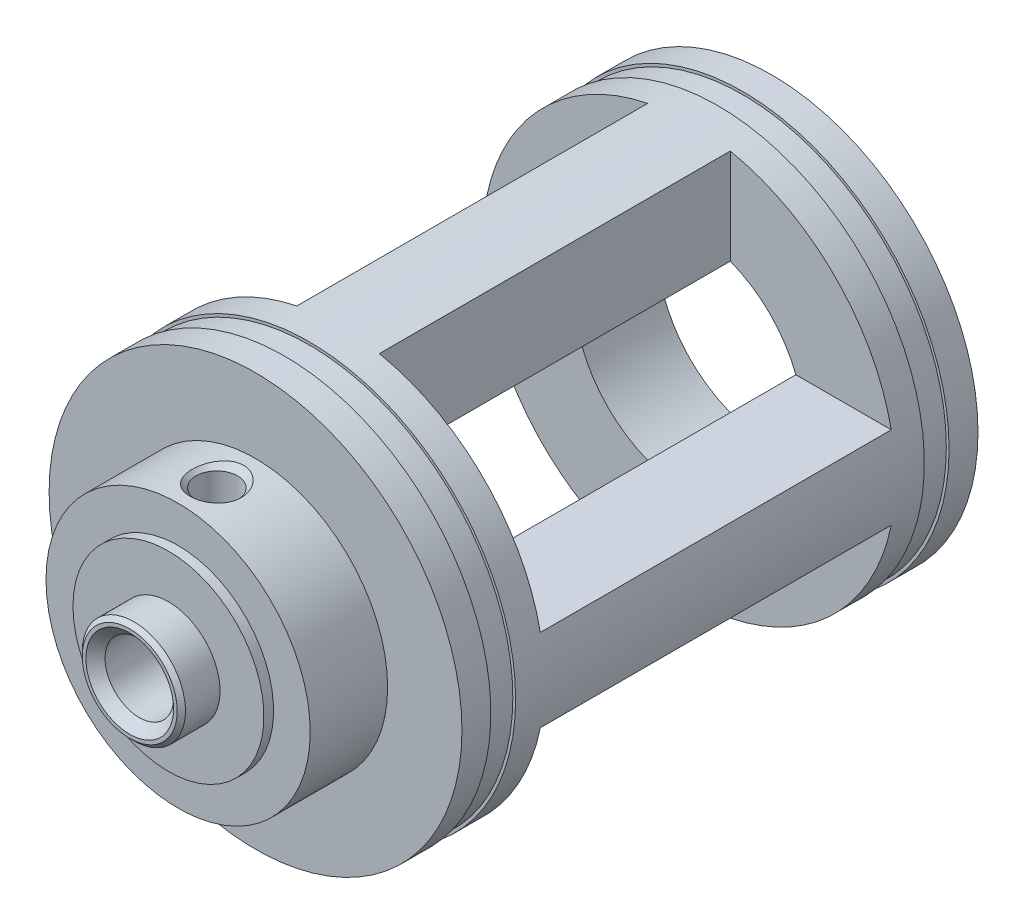
from build123d import *

# Parameters (mm, degrees)
SKETCH1_R                                      = 25.4
BOSS_EXTRUDE1_DEPTH                            = 63.5
SKETCH2_R                                      = 14.097
CUT_EXTRUDE1_DEPTH                             = 63.5
SKETCH4_W                                      = 20.32
SKETCH4_H                                      = 43.18
CUT_EXTRUDE3_DEPTH                             = 75.876167103
SKETCH8_R                                      = 14.097
BOSS_EXTRUDE3_DEPTH                            = 10.16
SKETCH10_R                                     = 16.256
BOSS_EXTRUDE4_DEPTH                            = 9.525
SKETCH26_R                                     = 11.7475
BOSS_EXTRUDE8_DEPTH                            = 1.190625
SKETCH11_R                                     = 6.35
BOSS_EXTRUDE5_DEPTH                            = 4.7625
CBORE_FOR_8_SOCKET_HEAD_CAP_SCREW1_D           = 4.4958
CBORE_FOR_8_SOCKET_HEAD_CAP_SCREW1_CBORE_D     = 7.9375
CBORE_FOR_8_SOCKET_HEAD_CAP_SCREW1_CBORE_DEPTH = 22.475825
SKETCH17_W                                     = 3.048
SKETCH17_H                                     = 0.508
CIRPATTERN1_COUNT                              = 2
CIRPATTERN1_ANGLE                              = 90
CHAMFER1_SIZE                                  = 0.508


# Read off the part's stored shape, not the designer's step: 1/4-20 Tapped Hole1, 3/8-24 Tapped Hole1
with BuildPart() as part:
    # Sketch1 → Boss-Extrude1 (new body)
    with BuildSketch(Plane.XY):
        Circle(SKETCH1_R)
    extrude(amount=BOSS_EXTRUDE1_DEPTH)

    # Sketch2 → Cut-Extrude1 (cut)
    with BuildSketch(Plane.XY.offset(63.5)):
        Circle(SKETCH2_R)
    extrude(amount=-CUT_EXTRUDE1_DEPTH, mode=Mode.SUBTRACT)

    # Sketch4 → Cut-Extrude3 (cut, through all)
    with BuildSketch(Plane(origin=(0, 5.08, 0), x_dir=(1, 0, 0), z_dir=(0, 1, 0))):
        with Locations((-15.24, -31.75)):
            Rectangle(SKETCH4_W, SKETCH4_H)
        with Locations((15.24, -31.75)):
            Rectangle(SKETCH4_W, SKETCH4_H)
    cut_extrude3 = extrude(amount=CUT_EXTRUDE3_DEPTH, mode=Mode.SUBTRACT)

    # Mirror1: Cut-Extrude3 across plane
    add(cut_extrude3.mirror(Plane.ZX), mode=Mode.SUBTRACT)

    # Sketch8 → Boss-Extrude3 (add)
    with BuildSketch(Plane.XY.offset(63.5)):
        Circle(SKETCH8_R)
    extrude(amount=-BOSS_EXTRUDE3_DEPTH)

    # Sketch10 → Boss-Extrude4 (add)
    with BuildSketch(Plane.XY.offset(63.5)):
        with Locations(Location((0, 0, 0), (0, 0, 180))):
            Circle(SKETCH10_R)
    extrude(amount=BOSS_EXTRUDE4_DEPTH)

    # Sketch26 → Boss-Extrude8 (add)
    with BuildSketch(Plane.XY.offset(73.025)):
        with Locations(Location((0, 0, 0), (0, 0, 180))):
            Circle(SKETCH26_R)
    extrude(amount=BOSS_EXTRUDE8_DEPTH)

    # Sketch11 → Boss-Extrude5 (add)
    with BuildSketch(Plane.XY.offset(74.215625)):
        with Locations(Location((0, 0, 0), (0, 0, 180))):
            Circle(SKETCH11_R)
    extrude(amount=BOSS_EXTRUDE5_DEPTH)

    # CBORE for #8 Socket Head Cap Screw1 (through all)
    with Locations(Plane.XY.offset(78.978125)):
        with Locations((0, 0)):
            CounterBoreHole(CBORE_FOR_8_SOCKET_HEAD_CAP_SCREW1_D / 2, CBORE_FOR_8_SOCKET_HEAD_CAP_SCREW1_CBORE_D / 2, CBORE_FOR_8_SOCKET_HEAD_CAP_SCREW1_CBORE_DEPTH)

    # Sketch17 → Cut-Revolve5 (revolve, cut)
    with BuildSketch(Plane(origin=(0, 0, 0), x_dir=(0, 0, -1), z_dir=(1, 0, 0)), mode=Mode.PRIVATE) as cut_revolve5_sk:
        with Locations((-58.42, 25.313514496)):
            Rectangle(SKETCH17_W, SKETCH17_H)
        with Locations((-5.08, 25.313514496)):
            Rectangle(SKETCH17_W, SKETCH17_H)
    revolve(cut_revolve5_sk.sketch.rotate(Axis((0, 0, 78.978125), (0, 0, -1)), 90), axis=Axis((0, 0, 78.978125), (0, 0, -1)), mode=Mode.SUBTRACT)

    # 1/4-20 Tapped Hole1 outline → 1/4-20 Tapped Hole1 (revolve, cut)
    with BuildSketch(Plane.YX.offset(-68.2625)):
        Polygon((0, -16.256120693), (3.302120693, -16.256120693), (2.5527, -15.5067), (2.5527, -3.038383775), (0, -3.038383775), align=None)
    f_1_4_20_tapped_hole1 = revolve(axis=Axis((0, 0, 68.2625), (1, 0, 0)), mode=Mode.SUBTRACT)

    # 3/8-24 Tapped Hole1 outline → 3/8-24 Tapped Hole1 (revolve, cut)
    with BuildSketch(Plane.XZ):
        Polygon((3.96875, 56.5023), (4.2164, 56.5023), (4.2164, 77.797025), (5.3975, 78.978125), (3.96875, 78.978125), align=None)
    revolve(axis=Axis((0, 0, 0), (0, 0, 1)), mode=Mode.SUBTRACT)

    # CirPattern1: 1/4-20 Tapped Hole1 ×2 about axis
    cirpattern1_axis = Axis((0, 0, 73.025), (0, 0, -1))
    for i in range(1, CIRPATTERN1_COUNT):
        add(f_1_4_20_tapped_hole1.rotate(cirpattern1_axis, i * CIRPATTERN1_ANGLE / (CIRPATTERN1_COUNT - 1)), mode=Mode.SUBTRACT)

    # Chamfer1
    chamfer1_edges = [part.edges().sort_by_distance(p)[0] for p in [
        (6.35, 0, 78.978125),
    ]]
    chamfer(chamfer1_edges, length=CHAMFER1_SIZE)


solid = part.part
